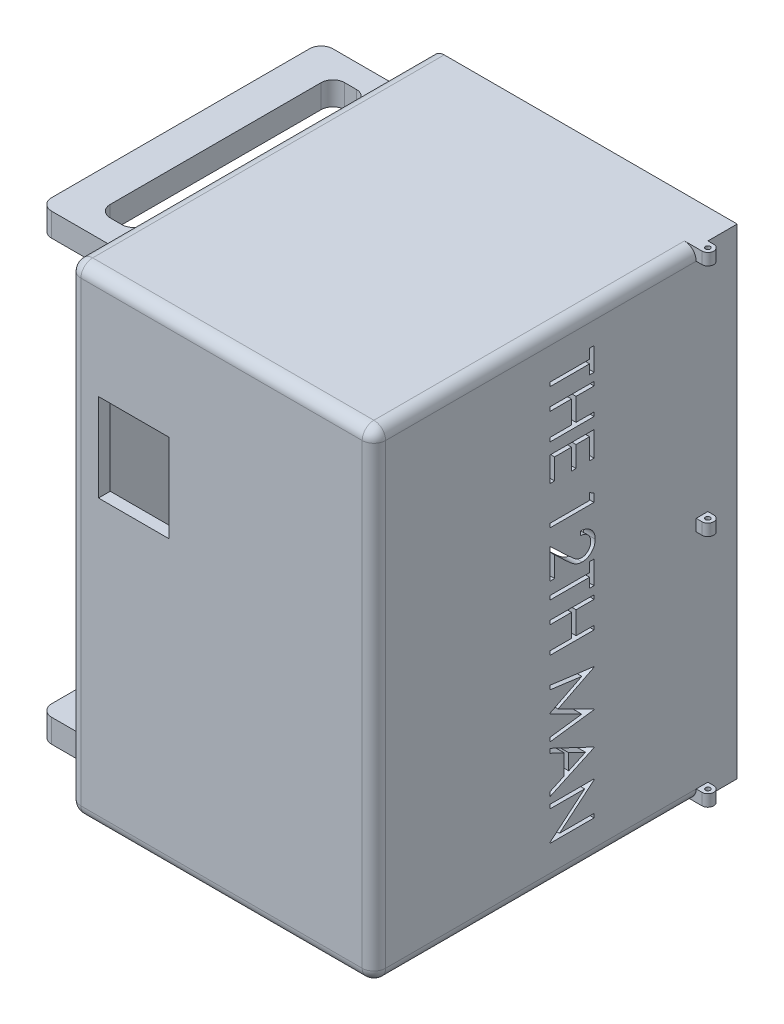
from build123d import *

# Parameters (mm, degrees)
SKETCH1_W                = 66.04
SKETCH1_H                = 104.14
BOSS_EXTRUDE1_DEPTH      = 78.74
SHELL3_T                 = -2.54
CUT_EXTRUDE7_DEPTH       = 40.64
CUT_EXTRUDE9_DEPTH       = 40.64
SKETCH8_W                = 60.96
SKETCH8_H                = 5.08
BOSS_EXTRUDE3_DEPTH      = 15.24
SKETCH11_R               = 0.508
BOSS_EXTRUDE4_DEPTH      = 2.54
LPATTERN1_COUNT          = 3
LPATTERN1_PITCH          = 50.8
FILLET1_R                = 2.54
CUT_EXTRUDE10_DEPTH      = 147.045361735
CUT_EXTRUDE10_DEPTH_BACK = 147.045361735
SKETCH9_W                = 7.62
SKETCH9_H                = 25.4
FILLET2_R                = 2.54
FILLET3_R                = 2.54
SKETCH12_W               = 20.32
SKETCH12_H               = 30.48
CUT_EXTRUDE11_DEPTH      = 2.54
SKETCH13_W               = 15.24
SKETCH13_H               = 19.05
CUT_EXTRUDE12_DEPTH      = 2.54


with BuildPart() as part:
    # Sketch1 → Boss-Extrude1 (new body)
    with BuildSketch(Plane.XY):
        with Locations((33.02, 52.07)):
            Rectangle(SKETCH1_W, SKETCH1_H)
    extrude(amount=BOSS_EXTRUDE1_DEPTH)

    # Shell3
    shell3_openings = [part.faces().sort_by_distance(p)[0] for p in [
        (33.02, 52.07, 0),
    ]]
    offset(amount=SHELL3_T, openings=shell3_openings, kind=Kind.INTERSECTION)

    # Sketch6 → Cut-Extrude7 (cut)
    # profile 1 of 10: a face of its own
    with BuildSketch(Plane(origin=(66.04, 0, 0), x_dir=(0, 0, -1), z_dir=(1, 0, 0))):
        Polygon((-31.996756627, 96.825288462), (-31.019833551, 96.825288462), (-31.019833551, 91.818557692), (-31.996756627, 91.818557692), (-31.996756627, 93.894519231), (-40.544833551, 93.894519231), (-40.544833551, 94.749326923), (-31.996756627, 94.749326923), align=None)
    # profile 2 of 10: a face of its own
    with BuildSketch(Plane(origin=(66.04, 0, 0), x_dir=(0, 0, -1), z_dir=(1, 0, 0))):
        Polygon((-31.019833551, 90.108942308), (-31.019833551, 89.254134615), (-34.927525858, 89.254134615), (-34.927525858, 84.369519231), (-31.019833551, 84.369519231), (-31.019833551, 83.514711538), (-40.544833551, 83.514711538), (-40.544833551, 84.369519231), (-35.904448935, 84.369519231), (-35.904448935, 89.254134615), (-40.544833551, 89.254134615), (-40.544833551, 90.108942308), align=None)
    # profile 3 of 10: a face of its own
    with BuildSketch(Plane(origin=(66.04, 0, 0), x_dir=(0, 0, -1), z_dir=(1, 0, 0))):
        Polygon((-31.019833551, 81.072403846), (-31.019833551, 75.699326923), (-31.996756627, 75.699326923), (-31.996756627, 80.217596154), (-34.927525858, 80.217596154), (-34.927525858, 75.699326923), (-35.904448935, 75.699326923), (-35.904448935, 80.217596154), (-39.567910474, 80.217596154), (-39.567910474, 75.699326923), (-40.544833551, 75.699326923), (-40.544833551, 81.072403846), align=None)
    # profile 4 of 10: a face of its own
    with BuildSketch(Plane(origin=(66.04, 0, 0), x_dir=(0, 0, -1), z_dir=(1, 0, 0))):
        Polygon((-31.019833551, 69.156613582), (-31.019833551, 67.395480769), (-40.544833551, 67.395480769), (-40.544833551, 68.250288462), (-31.996756627, 68.250288462), (-31.996756627, 69.715673077), align=None)
    # profile 5 of 10: a face of its own
    with BuildSketch(Plane(origin=(66.04, 0, 0), x_dir=(0, 0, -1), z_dir=(1, 0, 0))):
        with BuildLine():
            Line((-33.950602781, 62.632980769), (-33.950602781, 63.487788462))
            add(Edge.make_bspline(
                [(-33.950602781, 63.487788462), (-33.837197878, 63.482218229), (-33.614473665, 63.471278441), (-33.289750087, 63.420025178), (-32.979329471, 63.346756069), (-32.685873104, 63.242916648), (-32.405875402, 63.114684037), (-32.143054413, 62.957690211), (-31.894801667, 62.775282026), (-31.665817414, 62.567794117), (-31.456497177, 62.342650612), (-31.273825599, 62.101200471), (-31.121251832, 61.845925346), (-30.993010062, 61.579039383), (-30.896865922, 61.297455969), (-30.825497214, 61.003866724), (-30.782565304, 60.696944656), (-30.777950029, 60.48783026), (-30.775602781, 60.381478365)],
                knots=[0, 0, 0, 0, 1.100776268, 2.161895295, 3.184016182, 4.190939212, 5.176500551, 6.166955529, 7.155448256, 8.160289653, 9.16017456, 10.133824356, 11.091467644, 12.04088621, 13.000931625, 13.972173743, 14.968683325, 16, 16, 16, 16], degree=3))
            add(Edge.make_bspline(
                [(-30.775602781, 60.381478365), (-30.778047866, 60.277035178), (-30.782852371, 60.071808046), (-30.824112029, 59.772282135), (-30.888733961, 59.487138212), (-30.979399487, 59.216933648), (-31.101277107, 58.963824286), (-31.247683266, 58.725908715), (-31.417010093, 58.500354508), (-31.616365113, 58.297317476), (-31.829187317, 58.110877632), (-32.056393683, 57.950035066), (-32.291060525, 57.812294957), (-32.534977274, 57.697484199), (-32.790440572, 57.612967136), (-33.053731174, 57.548800727), (-33.32757441, 57.512531122), (-33.512921536, 57.506964648), (-33.607153262, 57.504134615)],
                knots=[0, 0, 0, 0, 1.111607364, 2.184268762, 3.212621178, 4.221274766, 5.211760367, 6.196651075, 7.1921475, 8.207485113, 9.220403448, 10.201281604, 11.166441695, 12.114753415, 13.065576456, 14.026450734, 14.996634279, 16, 16, 16, 16], degree=3))
            add(Edge.make_bspline(
                [(-33.607153262, 57.504134615), (-33.739817012, 57.508742709), (-34.002816451, 57.517878032), (-34.389299756, 57.596022156), (-34.763750418, 57.718068733), (-35.065114075, 57.865018683), (-35.307956655, 58.013261548), (-35.507896487, 58.146849694), (-35.723176369, 58.303236073), (-35.953075409, 58.484696842), (-36.199394372, 58.687478301), (-36.461984458, 58.913417189), (-36.738132632, 59.164124665), (-36.926742875, 59.340088156), (-37.024475978, 59.431268029)],
                knots=[0, 0, 0, 0, 1.184426356, 2.348067706, 3.509069118, 4.696110526, 5.333549288, 6.050745305, 6.844228056, 7.710549037, 8.667450064, 9.695053472, 10.805634456, 12, 12, 12, 12], degree=3))
            Line((-37.024475978, 59.431268029), (-39.567910474, 61.814426082))
            Line((-39.567910474, 61.814426082), (-39.567910474, 57.382019231))
            Line((-39.567910474, 57.382019231), (-40.544833551, 57.382019231))
            Line((-40.544833551, 57.382019231), (-40.544833551, 63.854134615))
            Line((-40.544833551, 63.854134615), (-36.602796291, 60.160144231))
            add(Edge.make_bspline(
                [(-36.602796291, 60.160144231), (-36.508916734, 60.0702004), (-36.32859332, 59.897436708), (-36.065246894, 59.653183612), (-35.821223644, 59.433452178), (-35.595442245, 59.238096647), (-35.389182666, 59.06695628), (-35.2008285, 58.920578652), (-35.031996146, 58.798316799), (-34.833658957, 58.668744712), (-34.591213606, 58.545189129), (-34.296423036, 58.436596414), (-33.992288171, 58.370855862), (-33.786825076, 58.362929391), (-33.683475377, 58.358942308)],
                knots=[0, 0, 0, 0, 1.329530082, 2.553755191, 3.672934919, 4.687409497, 5.60679272, 6.413407421, 7.126401618, 7.737995624, 8.834647426, 9.90044882, 10.943907757, 12, 12, 12, 12], degree=3))
            add(Edge.make_bspline(
                [(-33.683475377, 58.358942308), (-33.618476676, 58.360654663), (-33.490376716, 58.364029387), (-33.302685519, 58.394377114), (-33.120933467, 58.43896395), (-32.947367796, 58.507686036), (-32.778574803, 58.590253093), (-32.619686323, 58.695738596), (-32.465286227, 58.816280826), (-32.320668768, 58.9561039), (-32.188176719, 59.109603655), (-32.070820115, 59.271790415), (-31.972741593, 59.443375396), (-31.892341252, 59.623643525), (-31.829271059, 59.812090024), (-31.785568795, 60.009079965), (-31.758130032, 60.214068887), (-31.754417536, 60.354041473), (-31.752525858, 60.425363582)],
                knots=[0, 0, 0, 0, 0.991504627, 1.954065223, 2.895985987, 3.842598665, 4.797835564, 5.759220273, 6.74786863, 7.784730864, 8.824135544, 9.839918996, 10.835834653, 11.835434876, 12.84861661, 13.863796685, 14.911511676, 16, 16, 16, 16], degree=3))
            add(Edge.make_bspline(
                [(-31.752525858, 60.425363582), (-31.754471179, 60.499851679), (-31.758291468, 60.646134002), (-31.785031495, 60.860901823), (-31.831117999, 61.065803761), (-31.894301618, 61.261254599), (-31.973850295, 61.44744265), (-32.074843331, 61.622684403), (-32.193337583, 61.788579757), (-32.328414563, 61.944824021), (-32.479514174, 62.088387986), (-32.64587719, 62.217176527), (-32.828585783, 62.327019538), (-33.023513116, 62.424390424), (-33.235842064, 62.498893563), (-33.460427409, 62.562578129), (-33.700459972, 62.608840257), (-33.865836972, 62.624800282), (-33.950602781, 62.632980769)],
                knots=[0, 0, 0, 0, 1.031212865, 2.025131798, 2.990757446, 3.934781266, 4.865570067, 5.788494791, 6.729227313, 7.684356718, 8.643577152, 9.610526866, 10.590658432, 11.59095419, 12.621640561, 13.700587263, 14.82141059, 16, 16, 16, 16], degree=3))
        make_face()
    # profile 6 of 10: a face of its own
    with BuildSketch(Plane(origin=(66.04, 0, 0), x_dir=(0, 0, -1), z_dir=(1, 0, 0))):
        Polygon((-31.996756627, 56.771442308), (-31.019833551, 56.771442308), (-31.019833551, 51.764711538), (-31.996756627, 51.764711538), (-31.996756627, 53.840673077), (-40.544833551, 53.840673077), (-40.544833551, 54.695480769), (-31.996756627, 54.695480769), align=None)
    # profile 7 of 10: a face of its own
    with BuildSketch(Plane(origin=(66.04, 0, 0), x_dir=(0, 0, -1), z_dir=(1, 0, 0))):
        Polygon((-31.019833551, 50.055096154), (-31.019833551, 49.200288462), (-34.927525858, 49.200288462), (-34.927525858, 44.315673077), (-31.019833551, 44.315673077), (-31.019833551, 43.460865385), (-40.544833551, 43.460865385), (-40.544833551, 44.315673077), (-35.904448935, 44.315673077), (-35.904448935, 49.200288462), (-40.544833551, 49.200288462), (-40.544833551, 50.055096154), align=None)
    # profile 8 of 10: a face of its own
    with BuildSketch(Plane(origin=(66.04, 0, 0), x_dir=(0, 0, -1), z_dir=(1, 0, 0))):
        Polygon((-40.544833551, 37.843557692), (-31.019833551, 36.586150841), (-31.019833551, 36.464035457), (-38.835218166, 32.531538462), (-31.019833551, 28.608581731), (-31.019833551, 28.484558293), (-40.544833551, 27.219519231), (-40.544833551, 28.078143029), (-33.691107589, 28.990192308), (-40.544833551, 32.428503606), (-40.544833551, 32.621216947), (-33.675843166, 36.072884615), (-40.544833551, 36.983025841), align=None)
    # profile 9 of 10: a face of its own
    with BuildSketch(Plane(origin=(66.04, 0, 0), x_dir=(0, 0, -1), z_dir=(1, 0, 0))):
        Polygon((-31.019833551, 21.357980769), (-40.544833551, 16.961826923), (-40.544833551, 17.891048678), (-37.491948935, 19.299191707), (-37.491948935, 23.617115385), (-40.544833551, 25.065327524), (-40.544833551, 25.998365385), (-31.019833551, 21.480096154), align=None)
        Polygon((-32.876369007, 21.428578726), (-36.515025858, 23.153458534), (-36.515025858, 19.749492188), align=None, mode=Mode.SUBTRACT)
    # profile 10 of 10: a face of its own
    with BuildSketch(Plane(origin=(66.04, 0, 0), x_dir=(0, 0, -1), z_dir=(1, 0, 0))):
        Polygon((-40.544833551, 15.496442308), (-31.019833551, 15.496442308), (-31.019833551, 15.317085337), (-38.516573334, 9.024326923), (-31.019833551, 9.024326923), (-31.019833551, 8.169519231), (-40.544833551, 8.169519231), (-40.544833551, 8.364140625), (-33.065266243, 14.641634615), (-40.544833551, 14.641634615), align=None)
    extrude(amount=-CUT_EXTRUDE7_DEPTH, mode=Mode.SUBTRACT)


with BuildPart() as cut_extrude7_piece_1:
    # of the separate pieces the step leaves, piece 1, a body of its own (cut_extrude7_pieces)
    add(part.part.solids().sort_by_distance((0, 0, 0))[0])

    # Sketch7 → Cut-Extrude9 (cut)
    # profile 1 of 10: a face of its own
    with BuildSketch(Plane.ZY):
        Polygon((39.37, 88.399326923), (29.845, 88.399326923), (29.845, 88.578683894), (37.341739784, 94.871442308), (29.845, 94.871442308), (29.845, 95.72625), (39.37, 95.72625), (39.37, 95.531628606), (31.890432692, 89.254134615), (39.37, 89.254134615), align=None)
    # profile 2 of 10: a face of its own
    with BuildSketch(Plane.ZY):
        Polygon((29.845, 82.537788462), (39.37, 86.933942308), (39.37, 86.004720553), (36.317115385, 84.596577524), (36.317115385, 80.278653846), (39.37, 78.830441707), (39.37, 77.897403846), (29.845, 82.415673077), align=None)
        Polygon((31.701535457, 82.467190505), (35.340192308, 80.742310697), (35.340192308, 84.146277043), align=None, mode=Mode.SUBTRACT)
    # profile 3 of 10: a face of its own
    with BuildSketch(Plane.ZY):
        Polygon((39.37, 66.052211538), (29.845, 67.309618389), (29.845, 67.431733774), (37.660384615, 71.364230769), (29.845, 75.2871875), (29.845, 75.411210937), (39.37, 76.67625), (39.37, 75.817626202), (32.516274038, 74.905576923), (39.37, 71.467265625), (39.37, 71.274552284), (32.501009615, 67.822884615), (39.37, 66.912743389), align=None)
    # profile 4 of 10: a face of its own
    with BuildSketch(Plane.ZY):
        Polygon((29.845, 53.840673077), (29.845, 54.695480769), (33.752692308, 54.695480769), (33.752692308, 59.580096154), (29.845, 59.580096154), (29.845, 60.434903846), (39.37, 60.434903846), (39.37, 59.580096154), (34.729615385, 59.580096154), (34.729615385, 54.695480769), (39.37, 54.695480769), (39.37, 53.840673077), align=None)
    # profile 5 of 10: a face of its own
    with BuildSketch(Plane.ZY):
        Polygon((30.821923077, 47.124326923), (29.845, 47.124326923), (29.845, 52.131057692), (30.821923077, 52.131057692), (30.821923077, 50.055096154), (39.37, 50.055096154), (39.37, 49.200288462), (30.821923077, 49.200288462), align=None)
    # profile 6 of 10: a face of its own
    with BuildSketch(Plane.ZY):
        with BuildLine():
            Line((32.775769231, 41.262788462), (32.775769231, 40.407980769))
            add(Edge.make_bspline(
                [(32.775769231, 40.407980769), (32.662364886, 40.41355195), (32.439641772, 40.424493601), (32.114910283, 40.475733445), (31.804518295, 40.549051118), (31.51095803, 40.652714289), (31.231633847, 40.781454945), (30.967655233, 40.935841662), (30.720029212, 41.118704927), (30.49105136, 41.32609611), (30.2809909, 41.55134505), (30.099593417, 41.794384785), (29.946328897, 42.049777323), (29.818200661, 42.316747831), (29.722025794, 42.598308364), (29.650665475, 42.891903856), (29.607731277, 43.19882422), (29.603116318, 43.407938851), (29.600769231, 43.514290865)],
                knots=[0, 0, 0, 0, 1.10065271, 2.161652631, 3.183658789, 4.190468796, 5.17591951, 6.163126047, 7.15150782, 8.156236427, 9.156009102, 10.134482811, 11.092018607, 12.041330605, 13.001268258, 13.972401359, 14.968799086, 16, 16, 16, 16], degree=3))
            add(Edge.make_bspline(
                [(29.600769231, 43.514290865), (29.603194474, 43.618741403), (29.60795999, 43.823982978), (29.649500344, 44.12340491), (29.713157235, 44.409125244), (29.80748672, 44.677905914), (29.925849589, 44.932505364), (30.073049324, 45.169771232), (30.242120929, 45.395440852), (30.441549178, 45.598438753), (30.654339623, 45.784916815), (30.881598029, 45.945649629), (31.116590219, 46.084073994), (31.361151823, 46.197370013), (31.616079253, 46.283253433), (31.878928432, 46.346884817), (32.152732817, 46.383259954), (32.338085275, 46.388811946), (32.432319712, 46.391634615)],
                knots=[0, 0, 0, 0, 1.111674182, 2.184400057, 3.212814286, 4.223731311, 5.211378316, 6.196328225, 7.191884489, 8.207283132, 9.220262353, 10.201199469, 11.166417575, 12.120932471, 13.06540007, 14.026332106, 14.996573967, 16, 16, 16, 16], degree=3))
            add(Edge.make_bspline(
                [(32.432319712, 46.391634615), (32.564983404, 46.387026449), (32.82798273, 46.377890983), (33.214466872, 46.29974792), (33.588914347, 46.177697303), (33.890288277, 46.030760376), (34.133107866, 45.882488363), (34.333132229, 45.74900739), (34.548448015, 45.59185716), (34.779926712, 45.412380296), (35.024536912, 45.207485951), (35.287269319, 44.982497253), (35.563265831, 44.731603791), (35.751897976, 44.555667158), (35.849642428, 44.464501202)],
                knots=[0, 0, 0, 0, 1.184416499, 2.348048165, 3.509039915, 4.696071444, 5.333504901, 6.05069495, 6.844171097, 7.714965912, 8.667477798, 9.695072654, 10.805644396, 12, 12, 12, 12], degree=3))
            Line((35.849642428, 44.464501202), (38.393076923, 42.081343149))
            Line((38.393076923, 42.081343149), (38.393076923, 46.51375))
            Line((38.393076923, 46.51375), (39.37, 46.51375))
            Line((39.37, 46.51375), (39.37, 40.041634615))
            Line((39.37, 40.041634615), (35.42796274, 43.735625))
            add(Edge.make_bspline(
                [(35.42796274, 43.735625), (35.334078063, 43.825562463), (35.153744813, 43.998313924), (34.890465757, 44.242650794), (34.646218792, 44.462104041), (34.4214654, 44.658094231), (34.212918062, 44.826369699), (34.027331047, 44.975700559), (33.856549293, 45.095349775), (33.658590908, 45.225203816), (33.41689453, 45.350971865), (33.121527848, 45.459046205), (32.81747011, 45.524945186), (32.611996709, 45.532850488), (32.508641827, 45.536826923)],
                knots=[0, 0, 0, 0, 1.329631726, 2.553950428, 3.673215718, 4.687767853, 5.603093632, 6.413772471, 7.123043292, 7.734684054, 8.834405432, 9.900288307, 10.943827018, 12, 12, 12, 12], degree=3))
            add(Edge.make_bspline(
                [(32.508641827, 45.536826923), (32.443650307, 45.535096796), (32.315564501, 45.531687047), (32.127770257, 45.501594313), (31.946618871, 45.456117865), (31.771553129, 45.390952555), (31.604333176, 45.30493707), (31.444755462, 45.200234514), (31.290480492, 45.079430127), (31.145827588, 44.939681316), (31.013345165, 44.786161394), (30.895986047, 44.623979901), (30.797908181, 44.452393545), (30.717507663, 44.272125784), (30.654437519, 44.083679186), (30.610735242, 43.886689272), (30.583296482, 43.681700342), (30.579583986, 43.541727757), (30.577692308, 43.470405649)],
                knots=[0, 0, 0, 0, 0.991446411, 1.95395049, 2.89581595, 3.838931463, 4.798493298, 5.75982156, 6.748411868, 7.785213223, 8.824556874, 9.840280684, 10.836137867, 11.835679398, 12.848801643, 13.863922112, 14.911575587, 16, 16, 16, 16], degree=3))
            add(Edge.make_bspline(
                [(30.577692308, 43.470405649), (30.579561434, 43.395899187), (30.583232091, 43.249580797), (30.611035472, 43.035208996), (30.653185411, 42.829295532), (30.720128714, 42.634912816), (30.799225553, 42.447851615), (30.899709563, 42.27210539), (31.016474215, 42.104756214), (31.151867591, 41.948556658), (31.303991836, 41.80589675), (31.471643256, 41.678788834), (31.653614894, 41.568459178), (31.849159903, 41.472063135), (32.060225182, 41.393815659), (32.286013537, 41.334014724), (32.525558092, 41.286698384), (32.690980267, 41.270890809), (32.775769231, 41.262788462)],
                knots=[0, 0, 0, 0, 1.030878251, 2.024474673, 2.987898669, 3.934362936, 4.864849709, 5.795128259, 6.730474222, 7.685293701, 8.650606017, 9.611896181, 10.591709709, 11.591680886, 12.625074257, 13.701333388, 14.821793024, 16, 16, 16, 16], degree=3))
        make_face()
    # profile 7 of 10: a face of its own
    with BuildSketch(Plane.ZY):
        Polygon((29.845, 34.739155649), (29.845, 36.500288462), (39.37, 36.500288462), (39.37, 35.645480769), (30.821923077, 35.645480769), (30.821923077, 34.180096154), align=None)
    # profile 8 of 10: a face of its own
    with BuildSketch(Plane.ZY):
        Polygon((29.845, 22.823365385), (29.845, 28.196442308), (30.821923077, 28.196442308), (30.821923077, 23.678173077), (33.752692308, 23.678173077), (33.752692308, 28.196442308), (34.729615385, 28.196442308), (34.729615385, 23.678173077), (38.393076923, 23.678173077), (38.393076923, 28.196442308), (39.37, 28.196442308), (39.37, 22.823365385), align=None)
    # profile 9 of 10: a face of its own
    with BuildSketch(Plane.ZY):
        Polygon((29.845, 13.786826923), (29.845, 14.641634615), (33.752692308, 14.641634615), (33.752692308, 19.52625), (29.845, 19.52625), (29.845, 20.381057692), (39.37, 20.381057692), (39.37, 19.52625), (34.729615385, 19.52625), (34.729615385, 14.641634615), (39.37, 14.641634615), (39.37, 13.786826923), align=None)
    # profile 10 of 10: a face of its own
    with BuildSketch(Plane.ZY):
        Polygon((30.821923077, 7.070480769), (29.845, 7.070480769), (29.845, 12.077211538), (30.821923077, 12.077211538), (30.821923077, 10.00125), (39.37, 10.00125), (39.37, 9.146442308), (30.821923077, 9.146442308), align=None)
    extrude(amount=-CUT_EXTRUDE9_DEPTH, mode=Mode.SUBTRACT)


with BuildPart() as cut_extrude7_piece_2:
    # of the separate pieces the step leaves, piece 2, a body of its own (cut_extrude7_pieces)
    add(part.part.solids().sort_by_distance((66.04, 21.428578726, 32.876369007))[0])


with BuildPart() as cut_extrude9_piece_1:
    # of the separate pieces the step leaves, piece 1, a body of its own (cut_extrude9_pieces)
    add(cut_extrude7_piece_1.part.solids().sort_by_distance((0, 0, 0))[0])

    # Sketch8 → Boss-Extrude3 (add)
    with BuildSketch(Plane.ZY):
        with Locations((39.37, 4.572)):
            Rectangle(SKETCH8_W, SKETCH8_H)
        with Locations((39.37, 99.568)):
            Rectangle(SKETCH8_W, SKETCH8_H)
    extrude(amount=BOSS_EXTRUDE3_DEPTH)

    # Sketch11 → Boss-Extrude4 (add)
    with BuildSketch(Plane(origin=(0, 0, 0), x_dir=(1, 0, 0), z_dir=(0, 1, 0))):
        with BuildLine():
            ThreePointArc((67.31, -6.35), (68.58, -7.62), (67.31, -8.89))
            Line((67.31, -8.89), (66.04, -8.89))
            Line((66.04, -8.89), (66.04, -6.35))
            Line((66.04, -6.35), (67.31, -6.35))
        make_face()
        with Locations(Location((67.31, -7.62, 0), (0, 0, 270))):
            Circle(SKETCH11_R, mode=Mode.SUBTRACT)
    boss_extrude4 = extrude(amount=BOSS_EXTRUDE4_DEPTH)

    # LPattern1: Boss-Extrude4 ×3
    with Locations(*[(0, i * LPATTERN1_PITCH, 0) for i in range(1, LPATTERN1_COUNT)]):
        add(boss_extrude4)

    # Fillet1
    # the kernel refuses this fillet: 2.54 mm, written as the material it takes off along each edge
    with BuildSketch(Plane(origin=(2.54, 101.6, 76.2), x_dir=(0, 0, 1), z_dir=(-1, 0, 0))) as fillet1_piece_1_section:
        Polygon((0, 0), (FILLET1_R * 1.02, 0), (FILLET1_R * 1.02, FILLET1_R * 1.02), (0, FILLET1_R * 1.02), align=None)
    fillet1_piece_1 = extrude(amount=FILLET1_R * 1.02, mode=Mode.PRIVATE)
    fillet1_piece_1 = fillet1_piece_1 - Plane(origin=(2.54, 101.6, 76.2), x_dir=(0, -0.7071067811865475, -0.7071067811865475), z_dir=(-1, 0, 0)) * Sphere(FILLET1_R, mode=Mode.PRIVATE)
    add(fillet1_piece_1, mode=Mode.SUBTRACT)
    with BuildSketch(Plane(origin=(2.54, 2.54, 76.2), x_dir=(-1, 0, 0), z_dir=(0, -1, 0))) as fillet1_piece_2_section:
        Polygon((0, 0), (FILLET1_R * 1.02, 0), (FILLET1_R * 1.02, -FILLET1_R * 1.02), (0, -FILLET1_R * 1.02), align=None)
    fillet1_piece_2 = extrude(amount=FILLET1_R * 1.02, mode=Mode.PRIVATE)
    fillet1_piece_2 = fillet1_piece_2 - Plane(origin=(2.54, 2.54, 76.2), x_dir=(0.7071067811865475, 0, -0.7071067811865475), z_dir=(0, -1, 0)) * Sphere(FILLET1_R, mode=Mode.PRIVATE)
    add(fillet1_piece_2, mode=Mode.SUBTRACT)
    with BuildSketch(Plane(origin=(63.5, 101.6, 76.2), x_dir=(0, 0, 1), z_dir=(0, 1, 0))) as fillet1_piece_3_section:
        Polygon((0, 0), (FILLET1_R * 1.02, 0), (FILLET1_R * 1.02, FILLET1_R * 1.02), (0, FILLET1_R * 1.02), align=None)
    fillet1_piece_3 = extrude(amount=FILLET1_R * 1.02, mode=Mode.PRIVATE)
    fillet1_piece_3 = fillet1_piece_3 - Plane(origin=(63.5, 101.6, 76.2), x_dir=(-0.7071067811865475, 0, -0.7071067811865475), z_dir=(0, 1, 0)) * Sphere(FILLET1_R, mode=Mode.PRIVATE)
    add(fillet1_piece_3, mode=Mode.SUBTRACT)
    with BuildSketch(Plane(origin=(63.5, 2.54, 76.2), x_dir=(0, 0, 1), z_dir=(0, -1, 0))) as fillet1_piece_4_section:
        Polygon((0, 0), (FILLET1_R * 1.02, 0), (FILLET1_R * 1.02, -FILLET1_R * 1.02), (0, -FILLET1_R * 1.02), align=None)
    fillet1_piece_4 = extrude(amount=FILLET1_R * 1.02, mode=Mode.PRIVATE)
    fillet1_piece_4 = fillet1_piece_4 - Plane(origin=(63.5, 2.54, 76.2), x_dir=(-0.7071067811865475, 0, -0.7071067811865475), z_dir=(0, -1, 0)) * Sphere(FILLET1_R, mode=Mode.PRIVATE)
    add(fillet1_piece_4, mode=Mode.SUBTRACT)
    with BuildSketch(Plane(origin=(0, 101.6, 78.74), x_dir=(0, 0, -1), z_dir=(0, -1, 0))) as fillet1_piece_5:
        with BuildLine():
            CenterArc((FILLET1_R, FILLET1_R), FILLET1_R, 180, 90)
            Line((0, FILLET1_R), (0, 0))
            Line((0, 0), (FILLET1_R, 0))
        make_face()
    extrude(amount=99.06, mode=Mode.SUBTRACT)
    with BuildSketch(Plane(origin=(63.5, 104.14, 78.74), x_dir=(0, -1, 0), z_dir=(-1, 0, 0))) as fillet1_piece_6:
        with BuildLine():
            CenterArc((FILLET1_R, -FILLET1_R), FILLET1_R, 90, 90)
            Line((0, -FILLET1_R), (0, 0))
            Line((0, 0), (FILLET1_R, 0))
        make_face()
    extrude(amount=60.96, mode=Mode.SUBTRACT)
    with BuildSketch(Plane(origin=(66.04, 2.54, 78.74), x_dir=(-1, 0, 0), z_dir=(0, 1, 0))) as fillet1_piece_7:
        with BuildLine():
            CenterArc((FILLET1_R, -FILLET1_R), FILLET1_R, 90, 90)
            Line((0, -FILLET1_R), (0, 0))
            Line((0, 0), (FILLET1_R, 0))
        make_face()
    extrude(amount=99.06, mode=Mode.SUBTRACT)
    with BuildSketch(Plane(origin=(2.54, 0, 78.74), x_dir=(0, 0, -1), z_dir=(1, 0, 0))) as fillet1_piece_8:
        with BuildLine():
            CenterArc((FILLET1_R, FILLET1_R), FILLET1_R, 180, 90)
            Line((0, FILLET1_R), (0, 0))
            Line((0, 0), (FILLET1_R, 0))
        make_face()
    extrude(amount=60.96, mode=Mode.SUBTRACT)
    with BuildSketch(Plane(origin=(0, 0, -6.35), x_dir=(1, 0, 0), z_dir=(0, 0, 1))) as fillet1_piece_9_section:
        with BuildLine():
            CenterArc((FILLET1_R, FILLET1_R), FILLET1_R, 180, 90)
            Line((0, FILLET1_R), (0, 0))
            Line((0, 0), (FILLET1_R, 0))
        make_face()
    fillet1_piece_9 = extrude(amount=82.55, mode=Mode.PRIVATE)
    fillet1_piece_9 = split(fillet1_piece_9, bisect_by=Plane(origin=(0.570826666, 2.032, 4.445), z_dir=(0, -1, 0)), keep=Keep.TOP, mode=Mode.PRIVATE)
    add(fillet1_piece_9, mode=Mode.SUBTRACT)
    with BuildSketch(Plane(origin=(0, 0, -6.35), x_dir=(1, 0, 0), z_dir=(0, 0, 1))) as fillet1_piece_10_section:
        with BuildLine():
            CenterArc((FILLET1_R, FILLET1_R), FILLET1_R, 180, 90)
            Line((0, FILLET1_R), (0, 0))
            Line((0, 0), (FILLET1_R, 0))
        make_face()
    fillet1_piece_10 = extrude(amount=82.55, mode=Mode.PRIVATE)
    fillet1_piece_10 = split(fillet1_piece_10, bisect_by=Plane(origin=(0.015368493, 2.158741997, 8.89), z_dir=(0, 0, -1)), keep=Keep.TOP, mode=Mode.PRIVATE)
    add(fillet1_piece_10, mode=Mode.SUBTRACT)
    with BuildSketch(Plane(origin=(0, 0, -6.35), x_dir=(1, 0, 0), z_dir=(0, 0, 1))) as fillet1_piece_11_section:
        with BuildLine():
            CenterArc((FILLET1_R, FILLET1_R), FILLET1_R, 180, 90)
            Line((0, FILLET1_R), (0, 0))
            Line((0, 0), (FILLET1_R, 0))
        make_face()
    fillet1_piece_11 = extrude(amount=82.55, mode=Mode.PRIVATE)
    fillet1_piece_11 = split(fillet1_piece_11, bisect_by=Plane(origin=(0.015368493, 2.158741997, 69.85), z_dir=(0, 0, 1)), keep=Keep.TOP, mode=Mode.PRIVATE)
    add(fillet1_piece_11, mode=Mode.SUBTRACT)
    with BuildSketch(Plane(origin=(66.04, 0, 8.89), x_dir=(-1, 0, 0), z_dir=(0, 0, 1)), Plane(origin=(66.04, 104.14, 8.89), x_dir=(0, -1, 0), z_dir=(0, 0, 1))) as fillet1_piece_12:
        with BuildLine():
            CenterArc((FILLET1_R, -FILLET1_R), FILLET1_R, 90, 90)
            Line((0, -FILLET1_R), (0, 0))
            Line((0, 0), (FILLET1_R, 0))
        make_face()
    extrude(amount=67.31, mode=Mode.SUBTRACT)
    with BuildSketch(Plane(origin=(0, 104.14, -6.35), x_dir=(0, -1, 0), z_dir=(0, 0, 1))) as fillet1_piece_13_section:
        with BuildLine():
            CenterArc((FILLET1_R, FILLET1_R), FILLET1_R, 180, 90)
            Line((0, FILLET1_R), (0, 0))
            Line((0, 0), (FILLET1_R, 0))
        make_face()
    fillet1_piece_13 = extrude(amount=82.55, mode=Mode.PRIVATE)
    fillet1_piece_13 = split(fillet1_piece_13, bisect_by=Plane(origin=(0.015368493, 101.981258003, 8.89), z_dir=(0, 0, -1)), keep=Keep.TOP, mode=Mode.PRIVATE)
    add(fillet1_piece_13, mode=Mode.SUBTRACT)
    with BuildSketch(Plane(origin=(0, 104.14, -6.35), x_dir=(0, -1, 0), z_dir=(0, 0, 1))) as fillet1_piece_14_section:
        with BuildLine():
            CenterArc((FILLET1_R, FILLET1_R), FILLET1_R, 180, 90)
            Line((0, FILLET1_R), (0, 0))
            Line((0, 0), (FILLET1_R, 0))
        make_face()
    fillet1_piece_14 = extrude(amount=82.55, mode=Mode.PRIVATE)
    fillet1_piece_14 = split(fillet1_piece_14, bisect_by=Plane(origin=(0.570826666, 102.108, 39.37), z_dir=(0, 1, 0)), keep=Keep.TOP, mode=Mode.PRIVATE)
    add(fillet1_piece_14, mode=Mode.SUBTRACT)
    with BuildSketch(Plane(origin=(0, 104.14, -6.35), x_dir=(0, -1, 0), z_dir=(0, 0, 1))) as fillet1_piece_15_section:
        with BuildLine():
            CenterArc((FILLET1_R, FILLET1_R), FILLET1_R, 180, 90)
            Line((0, FILLET1_R), (0, 0))
            Line((0, 0), (FILLET1_R, 0))
        make_face()
    fillet1_piece_15 = extrude(amount=82.55, mode=Mode.PRIVATE)
    fillet1_piece_15 = split(fillet1_piece_15, bisect_by=Plane(origin=(0.015368493, 101.981258003, 69.85), z_dir=(0, 0, 1)), keep=Keep.TOP, mode=Mode.PRIVATE)
    add(fillet1_piece_15, mode=Mode.SUBTRACT)

    # Sketch9 → Cut-Extrude10 (cut, two sides: drawn at the far end of the back side and taken through both)
    with BuildSketch(Plane(origin=(0, 102.108, 0), x_dir=(1, 0, 0), z_dir=(0, 1, 0)).offset(-CUT_EXTRUDE10_DEPTH_BACK)):
        with Locations((-3.81, -52.07)):
            Rectangle(SKETCH9_W, SKETCH9_H)
        with Locations((-3.81, -26.67)):
            Rectangle(SKETCH9_W, SKETCH9_H)
    extrude(amount=CUT_EXTRUDE10_DEPTH + CUT_EXTRUDE10_DEPTH_BACK, mode=Mode.SUBTRACT)

    # Fillet2
    fillet2_edges = [cut_extrude9_piece_1.edges().sort_by_distance(p)[0] for p in [
        (0, 4.572, 13.97),
        (0, 99.568, 13.97),
        (0, 4.572, 64.77),
        (0, 99.568, 64.77),
        (-7.62, 4.572, 64.77),
        (-7.62, 99.568, 64.77),
        (-7.62, 4.572, 13.97),
        (-7.62, 99.568, 13.97),
    ]]
    fillet(fillet2_edges, radius=FILLET2_R)

    # Fillet3
    fillet3_edges = [cut_extrude9_piece_1.edges().sort_by_distance(p)[0] for p in [
        (-15.24, 4.572, 8.89),
        (-15.24, 4.572, 69.85),
        (-15.24, 99.568, 8.89),
        (-15.24, 99.568, 69.85),
    ]]
    fillet(fillet3_edges, radius=FILLET3_R)

    # Sketch12 → Cut-Extrude11 (cut)
    with BuildSketch(Plane.XZ):
        with Locations((43.18, 40.64)):
            Rectangle(SKETCH12_W, SKETCH12_H)
    extrude(amount=-CUT_EXTRUDE11_DEPTH, mode=Mode.SUBTRACT)

    # Sketch13 → Cut-Extrude12 (cut)
    with BuildSketch(Plane.XY.offset(78.74)):
        with Locations((13.97, 71.755)):
            Rectangle(SKETCH13_W, SKETCH13_H)
    extrude(amount=-CUT_EXTRUDE12_DEPTH, mode=Mode.SUBTRACT)


with BuildPart() as cut_extrude9_piece_2:
    # of the separate pieces the step leaves, piece 2, a body of its own (cut_extrude9_pieces)
    add(cut_extrude7_piece_1.part.solids().sort_by_distance((0, 82.467190505, 31.701535457))[0])


solid = Compound([cut_extrude7_piece_2.part, cut_extrude9_piece_1.part, cut_extrude9_piece_2.part])
